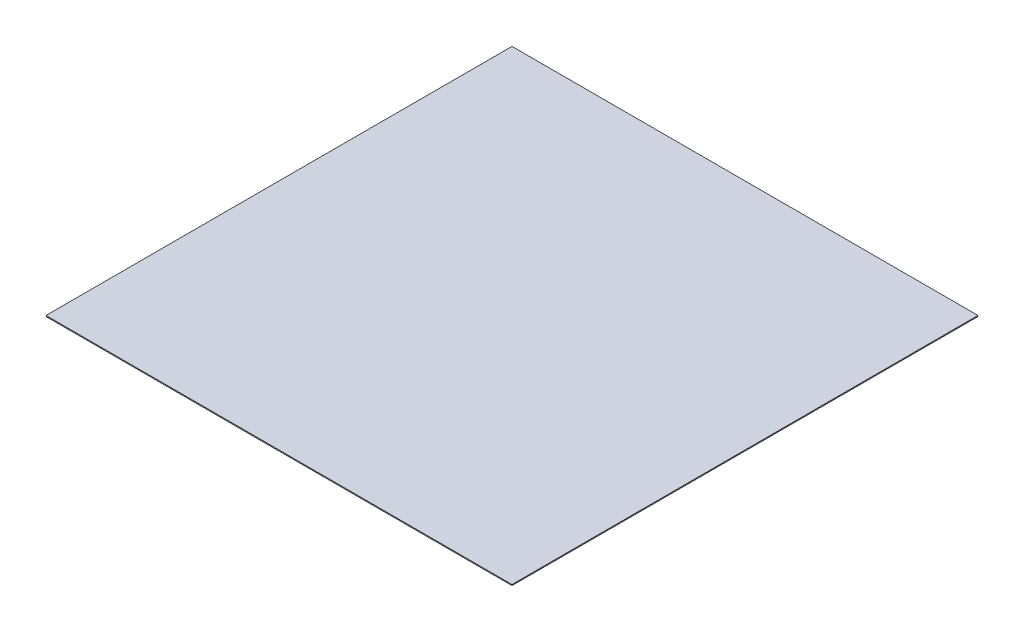
from build123d import *

# Parameters (mm, degrees)
SKETCH_1_W             = 960
SKETCH_1_H             = 960
SM_BASE_FLANGE_1_DEPTH = 2


# Sheet-metal steps are written as plain solids
with BuildPart() as part:
    # 基体-法兰1: sheet metal written as solids
    # Sketch 1 → 基体-法兰1 (new body)
    with BuildSketch(Plane(origin=(0, 0, 0), x_dir=(1, 0, 0), z_dir=(0, 1, 0))):
        Rectangle(SKETCH_1_W, SKETCH_1_H)
    extrude(amount=-SM_BASE_FLANGE_1_DEPTH)


solid = part.part
